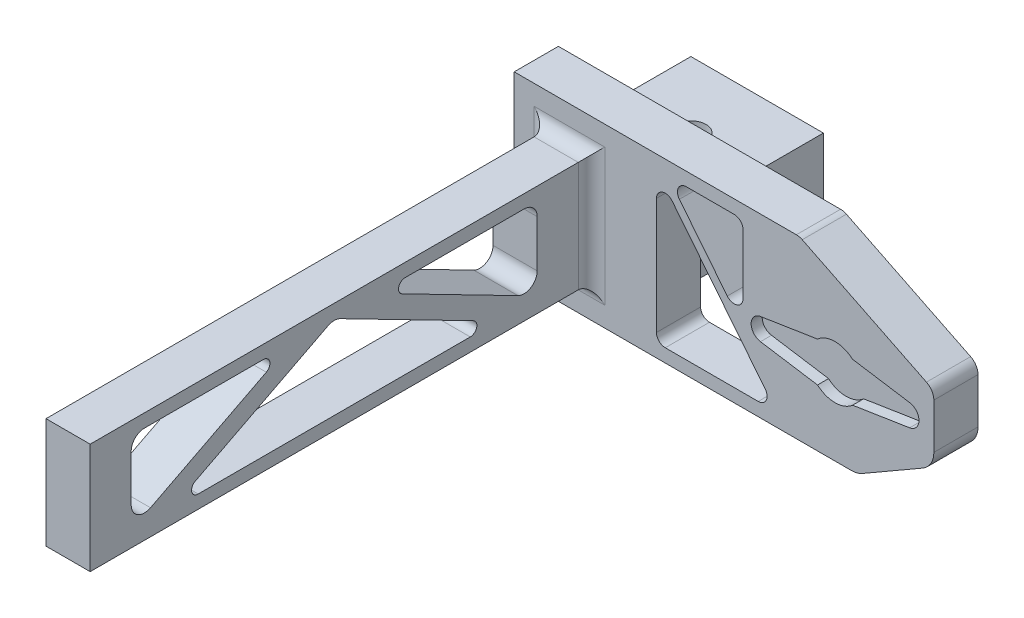
from build123d import *

# Parameters (mm, degrees)
SKETCH3_W             = 45
SKETCH3_H             = 15
BOSS_EXTRUDE1_DEPTH   = 10
CUT_EXTRUDE1_DEPTH    = 2.5
SKETCH11_W            = 45
SKETCH11_H            = 10
BOSS_EXTRUDE5_DEPTH   = 10
SKETCH14_W            = 45
SKETCH14_H            = 10
BOSS_EXTRUDE7_DEPTH   = 15
SKETCH20_W            = 10
SKETCH20_H            = 40
BOSS_EXTRUDE10_DEPTH  = 50
SKETCH21_W            = 10
SKETCH21_H            = 25
BOSS_EXTRUDE11_DEPTH  = 113.5
SKETCH22_W            = 30
SKETCH22_H            = 6
BOSS_EXTRUDE12_DEPTH  = 30
SKETCH23_W            = 30
SKETCH23_H            = 30
BOSS_EXTRUDE13_DEPTH  = 8.5
FILLET1_R             = 3
CHAMFER1_SIZE         = 15
CHAMFER1_SIZE2        = 30.41699103
FILLET2_R             = 3
CHAMFER2_SIZE         = 10
CHAMFER2_SIZE2        = 17.320508076
FILLET3_R             = 5
CUT_EXTRUDE2_DEPTH    = 146.077232094
FILLET4_R             = 3
FILLET5_R             = 1.5
CUT_EXTRUDE3_DEPTH    = 146.043287171
CUT_EXTRUDE4_DEPTH    = 137.629261703
FILLET6_R             = 2
M8_TAPPED_HOLE1_D     = 6.8
M8_TAPPED_HOLE1_DEPTH = 22.25
M8_TAPPED_HOLE1_TIP   = 2.042926105


with BuildPart() as part:
    # Sketch3 → Boss-Extrude1 (new body)
    with BuildSketch(Plane.XY):
        with Locations((-0.138845539, 0.05888455)):
            Rectangle(SKETCH3_W, SKETCH3_H)
    extrude(amount=-BOSS_EXTRUDE1_DEPTH)

    # Sketch2 → Cut-Extrude1 (cut)
    with BuildSketch(Plane.XY):
        with BuildLine():
            Line((-16.888114198, 2.469689731), (-3.968626967, 4.5))
            ThreePointArc((-3.968626967, 4.5), (0, 6), (3.968626967, 4.5))
            Line((3.968626967, 4.5), (16.888114198, 2.469689731))
            ThreePointArc((16.888114198, 2.469689731), (19, 0), (16.888114198, -2.469689731))
            Line((16.888114198, -2.469689731), (3.968626967, -4.5))
            ThreePointArc((3.968626967, -4.5), (0, -6), (-3.968626967, -4.5))
            Line((-3.968626967, -4.5), (-16.888114198, -2.469689731))
            ThreePointArc((-16.888114198, -2.469689731), (-19, 0), (-16.888114198, 2.469689731))
        make_face()
    extrude(amount=-CUT_EXTRUDE1_DEPTH, mode=Mode.SUBTRACT)

    # Sketch11 → Boss-Extrude5 (add)
    with BuildSketch(Plane.XZ.offset(7.44111545)):
        with Locations((-0.138845539, -5)):
            Rectangle(SKETCH11_W, SKETCH11_H)
    extrude(amount=BOSS_EXTRUDE5_DEPTH)

    # Sketch14 → Boss-Extrude7 (add)
    with BuildSketch(Plane(origin=(0, 7.55888455, 0), x_dir=(1, 0, 0), z_dir=(0, 1, 0))):
        with Locations((-0.138845539, 5)):
            Rectangle(SKETCH14_W, SKETCH14_H)
    extrude(amount=BOSS_EXTRUDE7_DEPTH)

    # Sketch20 → Boss-Extrude10 (add)
    with BuildSketch(Plane.ZY.offset(22.638845539)):
        with Locations((-5, 2.55888455)):
            Rectangle(SKETCH20_W, SKETCH20_H)
    extrude(amount=BOSS_EXTRUDE10_DEPTH)

    # Sketch21 → Boss-Extrude11 (add)
    with BuildSketch(Plane.XY):
        with Locations((-60.138845539, 2.55888455)):
            Rectangle(SKETCH21_W, SKETCH21_H)
    extrude(amount=BOSS_EXTRUDE11_DEPTH)

    # Sketch22 → Boss-Extrude12 (add)
    with BuildSketch(Plane(origin=(0, 0, -10), x_dir=(-1, 0, 0), z_dir=(0, 0, -1))):
        with Locations((57.638845539, 2.55888455)):
            Rectangle(SKETCH22_W, SKETCH22_H)
    extrude(amount=BOSS_EXTRUDE12_DEPTH)

    # Sketch23 → Boss-Extrude13 (add)
    with BuildSketch(Plane.XZ.offset(0.44111545)):
        with Locations((-57.638845539, -25)):
            Rectangle(SKETCH23_W, SKETCH23_H)
    extrude(amount=BOSS_EXTRUDE13_DEPTH)

    # Fillet1
    fillet1_edges = [part.edges().sort_by_distance(p)[0] for p in [
        (-60.138845539, 15.05888455, 0),
        (-65.138845539, 2.55888455, 0),
        (-55.138845539, 2.55888455, 0),
        (-60.138845539, -9.94111545, 0),
    ]]
    fillet(fillet1_edges, radius=FILLET1_R)

    # Chamfer1
    chamfer1_edges = [part.edges().sort_by_distance(p)[0] for p in [
        (22.361154461, 22.55888455, -5),
    ]]
    chamfer1_side = [part.faces().sort_by_distance(p)[0] for p in [
        (22.361154461, 2.55888455, -5),
    ]]
    chamfer(chamfer1_edges, length=CHAMFER1_SIZE, length2=CHAMFER1_SIZE2, reference=chamfer1_side[0])

    # Fillet2
    fillet2_edges = [part.edges().sort_by_distance(p)[0] for p in [
        (-8.055836569, 22.55888455, -5),
        (22.361154461, 7.55888455, -5),
    ]]
    fillet(fillet2_edges, radius=FILLET2_R)

    # Chamfer2
    chamfer2_edges = [part.edges().sort_by_distance(p)[0] for p in [
        (22.361154461, -17.44111545, -5),
    ]]
    chamfer2_side = [part.faces().sort_by_distance(p)[0] for p in [
        (22.361154461, -5.873875391, -5),
    ]]
    chamfer(chamfer2_edges, length=CHAMFER2_SIZE, length2=CHAMFER2_SIZE2, reference=chamfer2_side[0])

    # Fillet3
    fillet3_edges = [part.edges().sort_by_distance(p)[0] for p in [
        (5.040646385, -17.44111545, -5),
        (22.361154461, -7.44111545, -5),
    ]]
    fillet(fillet3_edges, radius=FILLET3_R)

    # Sketch24 → Cut-Extrude2 (cut, through all)
    with BuildSketch(Plane.ZY.offset(65.138845539)):
        Polygon((58.25, -6.94111545), (95.25, -6.94111545), (58.25, 12.05888455), (21.25, -6.94111545), align=None)
        Polygon((48.39896268, 12.05888455), (12.290027833, -6.483541453), (12.290027833, 12.05888455), align=None)
        Polygon((68.10103732, 12.05888455), (104.209972167, 12.05888455), (104.209972167, -6.483541453), align=None)
    extrude(amount=-CUT_EXTRUDE2_DEPTH, mode=Mode.SUBTRACT)

    # Fillet4
    fillet4_edges = [part.edges().sort_by_distance(p)[0] for p in [
        (-60.138845539, -6.483541453, 12.290027833),
        (-60.138845539, 12.05888455, 12.290027833),
        (-60.138845539, -6.483541453, 104.209972167),
        (-60.138845539, 12.05888455, 104.209972167),
        (-60.138845539, 12.05888455, 58.25),
    ]]
    fillet(fillet4_edges, radius=FILLET4_R)

    # Fillet5
    fillet5_edges = [part.edges().sort_by_distance(p)[0] for p in [
        (-60.138845539, 12.05888455, 68.10103732),
        (-60.138845539, -6.94111545, 95.25),
        (-60.138845539, -6.94111545, 21.25),
        (-60.138845539, 12.05888455, 48.39896268),
    ]]
    fillet(fillet5_edges, radius=FILLET5_R)

    # Sketch25 → Cut-Extrude3 (cut, through all)
    with BuildSketch(Plane(origin=(0, 0, -10), x_dir=(-1, 0, 0), z_dir=(0, 0, -1))):
        Polygon((40.438845539, 19.55888455), (13.231285806, -14.44111545), (40.438845539, -14.44111545), align=None)
    extrude(amount=-CUT_EXTRUDE3_DEPTH, mode=Mode.SUBTRACT)

    # Sketch26 → Cut-Extrude4 (cut, through all)
    with BuildSketch(Plane.XY):
        Polygon((-20.840242589, -1.731114095), (-20.840242589, 19.512981504), (-37.840242589, 19.512981504), align=None)
    extrude(amount=-CUT_EXTRUDE4_DEPTH, mode=Mode.SUBTRACT)

    # Fillet6
    fillet6_edges = [part.edges().sort_by_distance(p)[0] for p in [
        (-13.231285806, -14.44111545, -5),
        (-40.438845539, -14.44111545, -5),
        (-40.438845539, 19.55888455, -5),
        (-20.840242589, -1.731114095, -5),
        (-20.840242589, 19.512981504, -5),
        (-37.840242589, 19.512981504, -5),
    ]]
    fillet(fillet6_edges, radius=FILLET6_R)

    # M8 Tapped Hole1
    with Locations(Plane(origin=(0, 5.55888455, 0), x_dir=(1, 0, 0), z_dir=(0, 1, 0))):
        with Locations((-57.638845539, 25)):
            Hole(M8_TAPPED_HOLE1_D / 2, depth=M8_TAPPED_HOLE1_DEPTH)
            with Locations((0, 0, -(M8_TAPPED_HOLE1_DEPTH + M8_TAPPED_HOLE1_TIP / 2))):  # 118° drill point
                Cone(0, M8_TAPPED_HOLE1_D / 2, M8_TAPPED_HOLE1_TIP, mode=Mode.SUBTRACT)


solid = part.part
